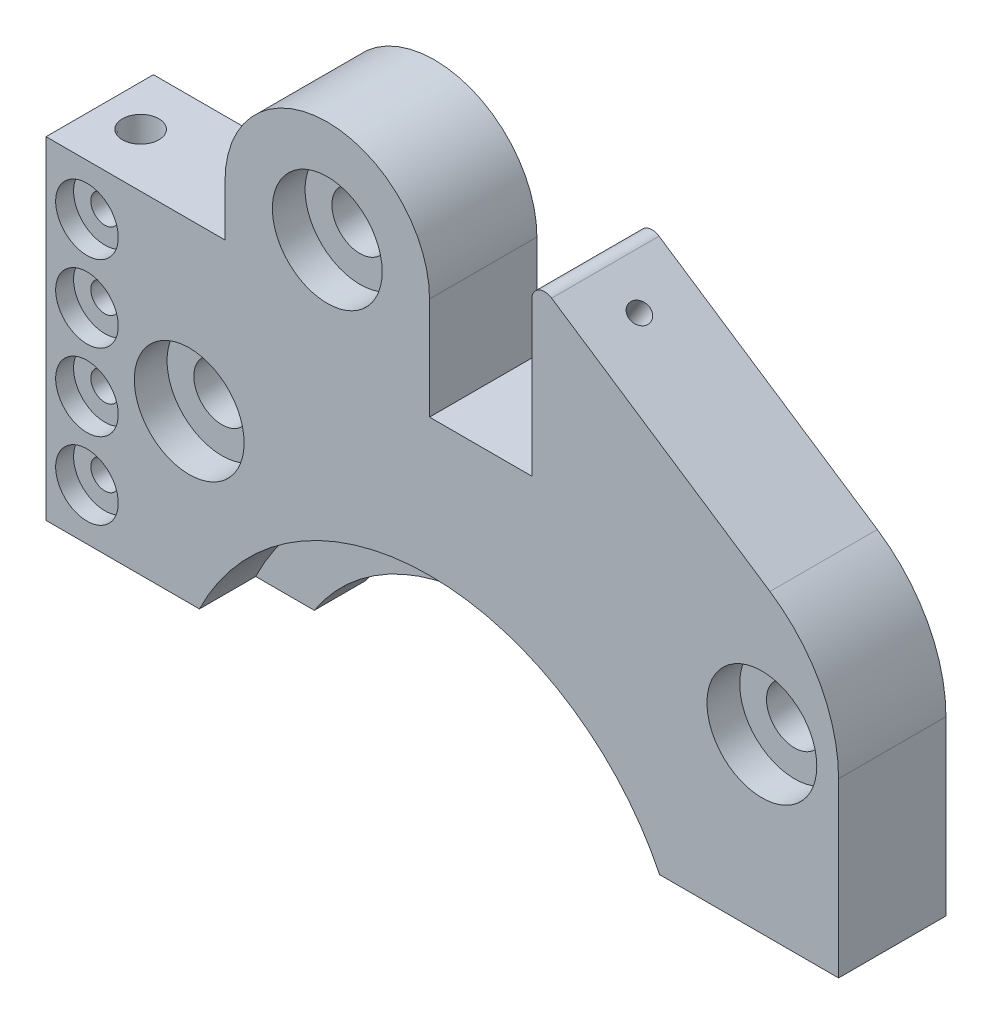
from build123d import *

# Parameters (mm, degrees)
BOSS_EXTRUDE1_DEPTH                      = 21
BOSS_EXTRUDE2_DEPTH                      = 10
CBORE_START                              = 17.5
CBORE_FOR_M5_HEX_HEAD_BOLT1_OUTLINE_R    = 6.119
CBORE_FOR_M5_HEX_HEAD_BOLT1_DEPTH        = 3.5
CBORE_START_2                            = 11.819091173
CBORE_FOR_M5_HEX_HEAD_BOLT1_2_OUTLINE_R  = 2.75
CBORE_FOR_M5_HEX_HEAD_BOLT1_2_DEPTH      = 5.680908827
CBORE_FOR_M10_HEX_HEAD_BOLT1_D           = 11
CBORE_FOR_M10_HEX_HEAD_BOLT1_CBORE_D     = 21.475
CBORE_FOR_M10_HEX_HEAD_BOLT1_CBORE_DEPTH = 6.4
F_4_0MM_DOWEL_HOLE1_D                    = 4
F_4_0MM_DOWEL_HOLE1_DEPTH                = 10
F_4_0MM_DOWEL_HOLE1_TIP                  = 1.201721238


# Read off the part's stored shape, not the designer's step: CBORE for M5 Hex Head Bolt1
with BuildPart() as part:
    # Sketch1 → Boss-Extrude1 (new body)
    with BuildSketch(Plane.XY):
        with BuildLine():
            Line((35, 65), (0, 65))
            Line((0, 65), (0, 0))
            Line((0, 0), (30, 0))
            ThreePointArc((30, 0), (75, 28.205505282), (120, 0))
            Line((120, 0), (155, 0))
            Line((155, 0), (155, 33.758563653))
            ThreePointArc((155, 33.758563653), (151.433820369, 47.944935308), (141.583123952, 58.758563653))
            Line((141.583123952, 58.758563653), (98.881926996, 87.083333333))
            ThreePointArc((98.881926996, 87.083333333), (96.317802362, 87.202818364), (95, 85))
            Line((95, 85), (95, 55))
            Line((95, 55), (75, 55))
            Line((75, 55), (75, 75))
            ThreePointArc((75, 75), (55, 95), (35, 75))
            Line((35, 75), (35, 65))
        make_face()
    extrude(amount=BOSS_EXTRUDE1_DEPTH)

    # Sketch2 → Boss-Extrude2 (add)
    with BuildSketch(Plane.XY):
        with BuildLine():
            Line((30, 0), (41.458980338, 0))
            ThreePointArc((41.458980338, 0), (75, 18.205505282), (108.541019662, 0))
            Line((108.541019662, 0), (120, 0))
            ThreePointArc((120, 0), (75, 28.205505282), (30, 0))
        make_face()
    extrude(amount=BOSS_EXTRUDE2_DEPTH)

    # Sketch16 → 1/16 Rc Tapped Hole1 (revolve, cut)
    with BuildSketch(Plane(origin=(8, 65, 10.5), x_dir=(0, 0, 1), z_dir=(1, 0, 0))):
        Polygon((0, 0), (0, 65), (3.05, 65), (3.05, 7.4), (3.339997004, 7.4), (3.571, 0), align=None)
    revolve(axis=Axis((8, 71.35, 10.5), (0, -1, 0)), mode=Mode.SUBTRACT)

    # CBORE for M5 Hex Head Bolt1 outline → CBORE for M5 Hex Head Bolt1 (cut)
    with BuildSketch(Plane.XY.offset(CBORE_START)):
        with Locations((8, 10)):
            Circle(CBORE_FOR_M5_HEX_HEAD_BOLT1_OUTLINE_R)
        with Locations((8, 25)):
            Circle(CBORE_FOR_M5_HEX_HEAD_BOLT1_OUTLINE_R)
        with Locations((8, 40)):
            Circle(CBORE_FOR_M5_HEX_HEAD_BOLT1_OUTLINE_R)
        with Locations((8, 55)):
            Circle(CBORE_FOR_M5_HEX_HEAD_BOLT1_OUTLINE_R)
    extrude(amount=CBORE_FOR_M5_HEX_HEAD_BOLT1_DEPTH, mode=Mode.SUBTRACT)

    # CBORE for M5 Hex Head Bolt1 2 outline → CBORE for M5 Hex Head Bolt1 2 (cut)
    with BuildSketch(Plane.XY.offset(CBORE_START_2)):
        with Locations((8, 10)):
            Circle(CBORE_FOR_M5_HEX_HEAD_BOLT1_2_OUTLINE_R)
        with Locations((8, 25)):
            Circle(CBORE_FOR_M5_HEX_HEAD_BOLT1_2_OUTLINE_R)
        with Locations((8, 40)):
            Circle(CBORE_FOR_M5_HEX_HEAD_BOLT1_2_OUTLINE_R)
        with Locations((8, 55)):
            Circle(CBORE_FOR_M5_HEX_HEAD_BOLT1_2_OUTLINE_R)
    extrude(amount=CBORE_FOR_M5_HEX_HEAD_BOLT1_2_DEPTH, mode=Mode.SUBTRACT)

    # CBORE for M10 Hex Head Bolt1 (through all)
    with Locations(Plane.XY.offset(21)):
        with Locations((28, 32.5), (55, 75), (140, 33.758563653)):
            CounterBoreHole(CBORE_FOR_M10_HEX_HEAD_BOLT1_D / 2, CBORE_FOR_M10_HEX_HEAD_BOLT1_CBORE_D / 2, CBORE_FOR_M10_HEX_HEAD_BOLT1_CBORE_DEPTH)

    # Ø4.0mm Dowel Hole1
    with Locations(Plane(origin=(70.328191882, 106.023738481, 0), x_dir=(0.8333333333333334, -0.5527707983925666, 0), z_dir=(0.5527707983925666, 0.8333333333333334, 0))):
        with Locations((42.264482137, -10.5)):
            Hole(F_4_0MM_DOWEL_HOLE1_D / 2, depth=F_4_0MM_DOWEL_HOLE1_DEPTH)
            with Locations((0, 0, -(F_4_0MM_DOWEL_HOLE1_DEPTH + F_4_0MM_DOWEL_HOLE1_TIP / 2))):  # 118° drill point
                Cone(0, F_4_0MM_DOWEL_HOLE1_D / 2, F_4_0MM_DOWEL_HOLE1_TIP, mode=Mode.SUBTRACT)


solid = part.part
